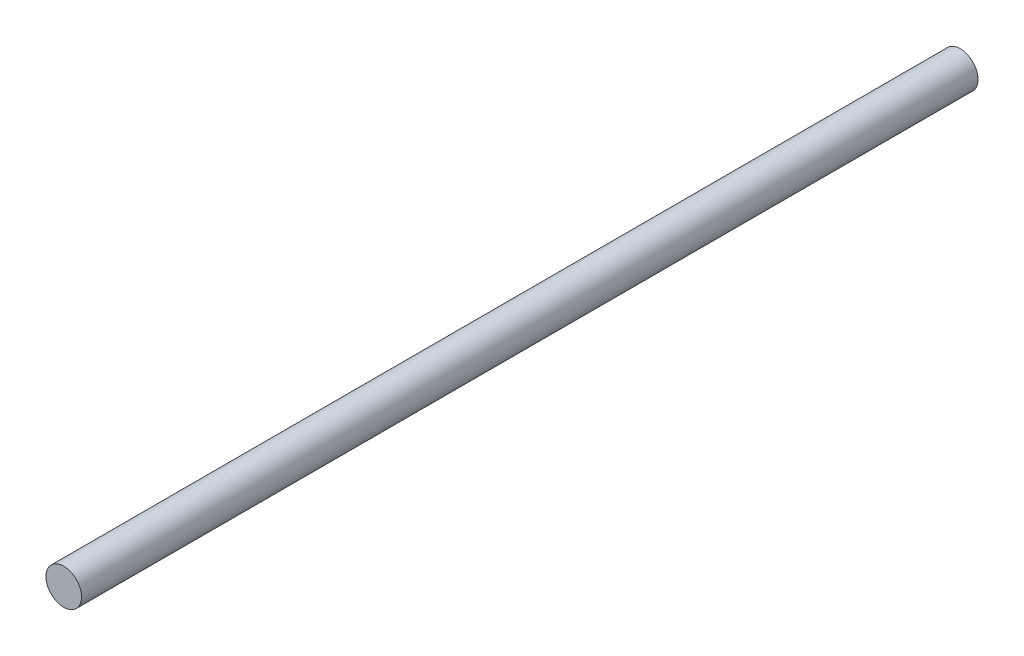
from build123d import *

# Parameters (mm, degrees)
SKETCH1_R           = 2.38125
BOSS_EXTRUDE1_DEPTH = 120


with BuildPart() as part:
    # Sketch1 → Boss-Extrude1 (new body)
    with BuildSketch(Plane.XY):
        Circle(SKETCH1_R)
    extrude(amount=BOSS_EXTRUDE1_DEPTH)


solid = part.part
